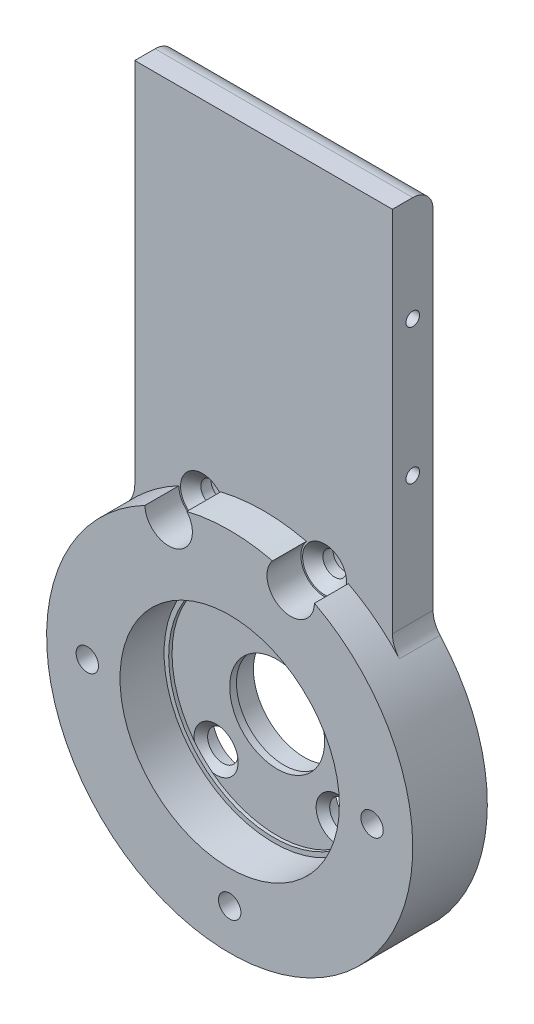
from build123d import *

# Parameters (mm, degrees)
SKETCH_1_W                    = 38
SKETCH_1_H                    = 94
EXTRUDE_604_DEPTH             = 6
CUT_EXTRUDE_1_DEPTH           = 78.601546376
CUT_EXTRUDE_1_DEPTH_BACK      = 78.601546376
SKETCH_5_R                    = 5
SKETCH_8_R                    = 27
EXTRUDE_996_DEPTH             = 5
EXTRUDE_996_DIRECTION_2_REACH = 79.602
SKETCH_6_R                    = 1.75
CUT_EXTRUDE_1278_DEPTH        = 81.467384697
SKETCH_16_R                   = 16.175
CUT_EXTRUDE_1486_DEPTH        = 7
SKETCH_7_R                    = 4.5
SKETCH_7_R_2                  = 7.5
CUT_EXTRUDE_1931_DEPTH        = 3
SKETCH_10_R                   = 3.5
CUT_EXTRUDE_2130_DEPTH        = 5
SKETCH_11_R                   = 1.65
CUT_EXTRUDE_2456_DEPTH        = 81.467384697
CUT_EXTRUDE_3_DEPTH           = 5
CHAMFER_1_SIZE                = 1.5
FILLET_5_R                    = 4
SKETCH_17_R                   = 7
CUT_EXTRUDE_3397_DEPTH        = 81.018747803
EXTRUDE_START                 = 0.5
SKETCH_18_R                   = 16.175
SKETCH_18_R_2                 = 15.5
EXTRUDE_3543_DEPTH            = 0.5
SKETCH_19_R                   = 1
CUT_EXTRUDE_3835_DEPTH        = 89.667919791
FILLET_6_R                    = 3


with BuildPart() as part:
    # Эскиз1 → Extrude 604 (new body)
    with BuildSketch(Plane.XY):
        with Locations((0, 28)):
            Rectangle(SKETCH_1_W, SKETCH_1_H)
    extrude(amount=EXTRUDE_604_DEPTH)

    # Эскиз5 → ось двигателя1 (cut, two sides: drawn at the far end of the back side and taken through both)
    with BuildSketch(Plane.XY.offset(6).offset(-CUT_EXTRUDE_1_DEPTH_BACK)):
        Circle(SKETCH_5_R)
    extrude(amount=CUT_EXTRUDE_1_DEPTH + CUT_EXTRUDE_1_DEPTH_BACK, mode=Mode.SUBTRACT)

    # Эскиз8 → Extrude 996 (add)
    with BuildSketch(Plane.XY.offset(6)):
        Circle(SKETCH_8_R)
    extrude(amount=EXTRUDE_996_DEPTH)

    # Extrude 996 direction 2: up to this face of the body (flat: up to its plane)
    extrude_996_direction_2_end = Plane(part.part.faces().sort_by_distance((0, 28.629494754, 0))[0])
    # Эскиз8 → Extrude 996 direction 2 (add, up to the picked face)
    with BuildSketch(Plane.XY.offset(6), mode=Mode.PRIVATE) as extrude_996_direction_2_sk1:
        Circle(SKETCH_8_R)
    extrude_996_direction_2_tool1 = split(extrude(extrude_996_direction_2_sk1.sketch, amount=-EXTRUDE_996_DIRECTION_2_REACH, mode=Mode.PRIVATE), bisect_by=extrude_996_direction_2_end, keep=Keep.BOTH, mode=Mode.PRIVATE)
    add(extrude_996_direction_2_tool1.solids().sort_by(Axis((0, 0, 6), (0, 0, -1)))[0])

    # Эскиз6 → Cut-Extrude 1278 (cut, through all)
    with BuildSketch(Plane(origin=(0, 0, 0), x_dir=(-1, 0, 0), z_dir=(0, 0, -1))):
        with Locations((-9, 24)):
            Circle(SKETCH_6_R)
        with Locations((9, 24)):
            Circle(SKETCH_6_R)
        with Locations((9, -9)):
            Circle(SKETCH_6_R)
        with Locations((-9, -9)):
            Circle(SKETCH_6_R)
    extrude(amount=-CUT_EXTRUDE_1278_DEPTH, mode=Mode.SUBTRACT)

    # Эскиз16 → Cut-Extrude 1486 (cut)
    with BuildSketch(Plane.XY.offset(11)):
        Circle(SKETCH_16_R)
    extrude(amount=-CUT_EXTRUDE_1486_DEPTH, mode=Mode.SUBTRACT)

    # Эскиз7 → Cut-Extrude 1931 (cut)
    with BuildSketch(Plane(origin=(0, 0, 0), x_dir=(-1, 0, 0), z_dir=(0, 0, -1))):
        with Locations((-9, 24)):
            Circle(SKETCH_7_R)
        with Locations((9, 24)):
            Circle(SKETCH_7_R)
        with Locations((-9, -9)):
            Circle(SKETCH_7_R)
        with Locations((9, -9)):
            Circle(SKETCH_7_R)
        Circle(SKETCH_7_R_2)
        with BuildLine():
            Line((-5, 16.5), (5, 16.5))
            ThreePointArc((5, 16.5), (8.5, 13), (5, 9.5))
            Line((5, 9.5), (-5, 9.5))
            ThreePointArc((-5, 9.5), (-8.5, 13), (-5, 16.5))
        make_face()
    extrude(amount=-CUT_EXTRUDE_1931_DEPTH, mode=Mode.SUBTRACT)

    # Эскиз10 → Cut-Extrude 2130 (cut)
    with BuildSketch(Plane.XY.offset(11)):
        with Locations((-9, 24)):
            Circle(SKETCH_10_R)
        with Locations((9, 24)):
            Circle(SKETCH_10_R)
    extrude(amount=-CUT_EXTRUDE_2130_DEPTH, mode=Mode.SUBTRACT)

    # Эскиз11 → Cut-Extrude 2456 (cut, through all)
    with BuildSketch(Plane.XY.offset(11)):
        with Locations((21, 0)):
            Circle(SKETCH_11_R)
        with Locations((-21, 0)):
            Circle(SKETCH_11_R)
        with Locations((0, -21)):
            Circle(SKETCH_11_R)
    extrude(amount=-CUT_EXTRUDE_2456_DEPTH, mode=Mode.SUBTRACT)

    # Эскиз12 → Вырез-Вытянуть3 (cut)
    with BuildSketch(Plane(origin=(0, 0, 0), x_dir=(-1, 0, 0), z_dir=(0, 0, -1))):
        Polygon((-18.1, 1.674315781), (-21, 3.348631561), (-23.9, 1.674315781), (-23.9, -1.674315781), (-21, -3.348631561), (-18.1, -1.674315781), align=None)
        Polygon((2.9, -19.325684219), (0, -17.651368439), (-2.9, -19.325684219), (-2.9, -22.674315781), (0, -24.348631561), (2.9, -22.674315781), align=None)
        Polygon((23.9, 1.674315781), (21, 3.348631561), (18.1, 1.674315781), (18.1, -1.674315781), (21, -3.348631561), (23.9, -1.674315781), align=None)
    extrude(amount=-CUT_EXTRUDE_3_DEPTH, mode=Mode.SUBTRACT)

    # Фаска1
    # the kernel refuses this chamfer: 1.5 mm, written as the material it takes off along each edge
    with BuildSketch(Plane(origin=(-9, 24, 6), x_dir=(-1, 0, 0), z_dir=(0, -1, 0))) as chamfer_1_piece_1:
        Polygon((1.75 + CHAMFER_1_SIZE, 0), (1.75, CHAMFER_1_SIZE), (1.75, 0), align=None)
    revolve(axis=Axis((-9, 24, 6), (0, 0, -1)), mode=Mode.SUBTRACT)
    with BuildSketch(Plane(origin=(9, -9, 4), x_dir=(-1, 0, 0), z_dir=(0, -1, 0))) as chamfer_1_piece_2:
        Polygon((1.75, CHAMFER_1_SIZE), (1.75 + CHAMFER_1_SIZE, 0), (1.75, 0), align=None)
    revolve(axis=Axis((9, -9, 4), (0, 0, -1)), mode=Mode.SUBTRACT)
    with BuildSketch(Plane(origin=(-9, -9, 4), x_dir=(-1, 0, 0), z_dir=(0, -1, 0))) as chamfer_1_piece_3:
        Polygon((1.75, CHAMFER_1_SIZE), (1.75 + CHAMFER_1_SIZE, 0), (1.75, 0), align=None)
    revolve(axis=Axis((-9, -9, 4), (0, 0, -1)), mode=Mode.SUBTRACT)
    with BuildSketch(Plane(origin=(9, 24, 6), x_dir=(-1, 0, 0), z_dir=(0, -1, 0))) as chamfer_1_piece_4:
        Polygon((1.75 + CHAMFER_1_SIZE, 0), (1.75, CHAMFER_1_SIZE), (1.75, 0), align=None)
    revolve(axis=Axis((9, 24, 6), (0, 0, -1)), mode=Mode.SUBTRACT)

    # Скругление5
    fillet_5_edges = [part.edges().sort_by_distance(p)[0] for p in [
        (-19, 19.183326093, 3),
        (19, 19.183326093, 3),
    ]]
    fillet(fillet_5_edges, radius=FILLET_5_R)

    # Эскиз17 → Cut-Extrude 3397 (cut, through all)
    with BuildSketch(Plane.XY.offset(4)):
        Circle(SKETCH_17_R)
    extrude(amount=-CUT_EXTRUDE_3397_DEPTH, mode=Mode.SUBTRACT)

    # Эскиз18 → Extrude 3543 (add)
    with BuildSketch(Plane.XY.offset(4).offset(EXTRUDE_START)):
        Circle(SKETCH_18_R)
        with Locations(Location((0, 0, 0), (0, 0, 218.075409453))):
            Circle(SKETCH_18_R_2, mode=Mode.SUBTRACT)
    extrude(amount=-EXTRUDE_3543_DEPTH)

    # Эскиз19 → Cut-Extrude 3835 (cut, through all)
    with BuildSketch(Plane(origin=(19, 0, 0), x_dir=(0, 0, -1), z_dir=(1, 0, 0))):
        with Locations(Location((-3, 59.5, 0), (0, 0, 90))):
            Circle(SKETCH_19_R)
        with Locations(Location((-3, 39.5, 0), (0, 0, 90))):
            Circle(SKETCH_19_R)
    extrude(amount=-CUT_EXTRUDE_3835_DEPTH, mode=Mode.SUBTRACT)

    # Скругление6
    fillet_6_edges = [part.edges().sort_by_distance(p)[0] for p in [
        (0, 75, 0),
    ]]
    fillet(fillet_6_edges, radius=FILLET_6_R)


solid = part.part
